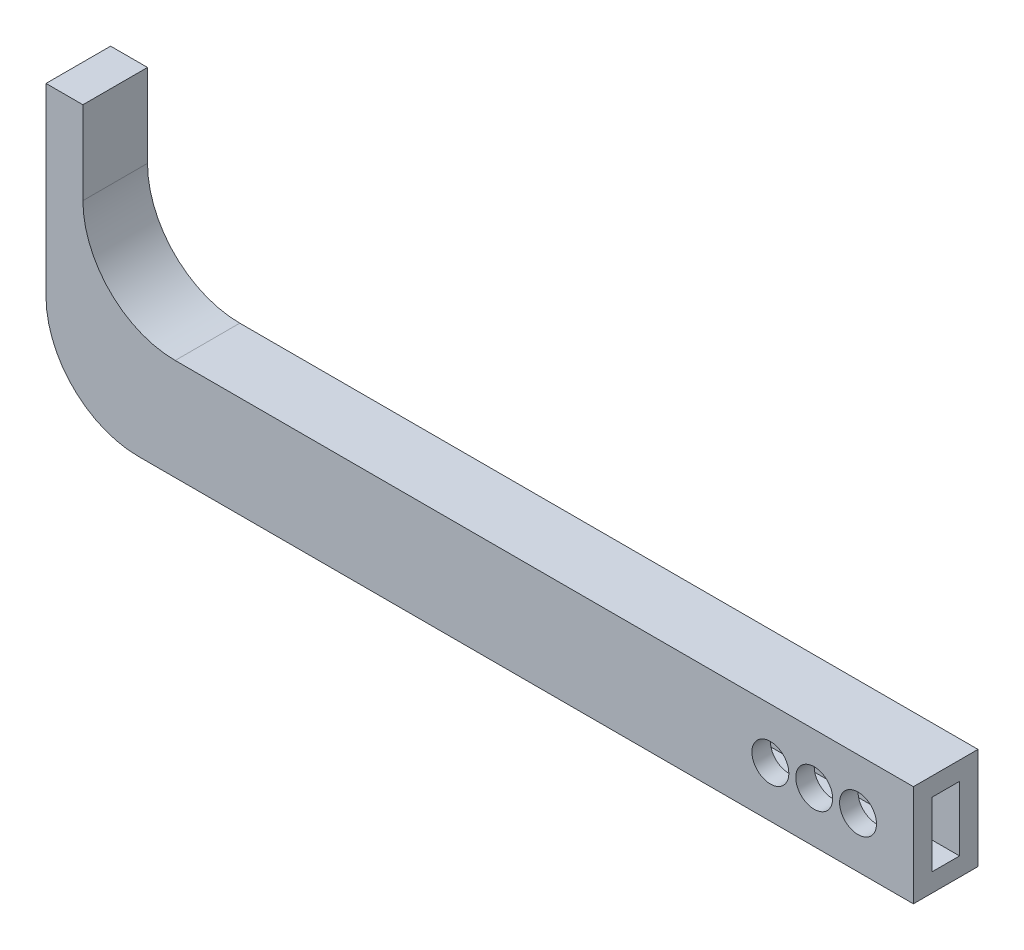
from build123d import *

# Parameters (mm, degrees)
BOSS_EXTRUDE1_DEPTH = 3.5
FILLET2_R           = 5
SHELL1_START        = 1
SHELL1_DEPTH        = 1.5
CUT_EXTRUDE1_START  = -3.5
SKETCH2_R           = 1
CUT_EXTRUDE1_DEPTH  = 3.5


# Read off the part's stored shape, not the designer's step: Shell1
with BuildPart() as part:
    # Sketch1 → Boss-Extrude1 (new body)
    with BuildSketch(Plane.XY):
        Polygon((0, 0), (-47, 0), (-47, 15), (-45, 15), (-45, 5.5), (0, 5.5), align=None)
    extrude(amount=BOSS_EXTRUDE1_DEPTH)

    # Fillet2
    fillet2_edges = [part.edges().sort_by_distance(p)[0] for p in [
        (-47, 0, 1.75),
        (-45, 5.5, 1.75),
    ]]
    fillet(fillet2_edges, radius=FILLET2_R)

    # Shell1 outline → Shell1 (cut)
    with BuildSketch(Plane.XY.offset(SHELL1_START)):
        with BuildLine():
            Line((0, 4.5), (-40, 4.5))
            ThreePointArc((-40, 4.5), (-44.242640687, 6.257359313), (-46, 10.5))
            Line((-46, 10.5), (-46, 5))
            ThreePointArc((-46, 5), (-44.828427125, 2.171572875), (-42, 1))
            Line((-42, 1), (0, 1))
            Line((0, 1), (0, 4.5))
        make_face()
    extrude(amount=SHELL1_DEPTH, mode=Mode.SUBTRACT)

    # Sketch2 → Cut-Extrude1 (cut)
    with BuildSketch(Plane.XY.offset(3.5).offset(CUT_EXTRUDE1_START)):
        with Locations(Location((-3, 2.75, 0), (0, 0, 180))):
            Circle(SKETCH2_R)
        with Locations(Location((-5.375, 2.75, 0), (0, 0, 180))):
            Circle(SKETCH2_R)
        with Locations(Location((-7.75, 2.75, 0), (0, 0, 180))):
            Circle(SKETCH2_R)
    extrude(amount=CUT_EXTRUDE1_DEPTH, mode=Mode.SUBTRACT)


solid = part.part
